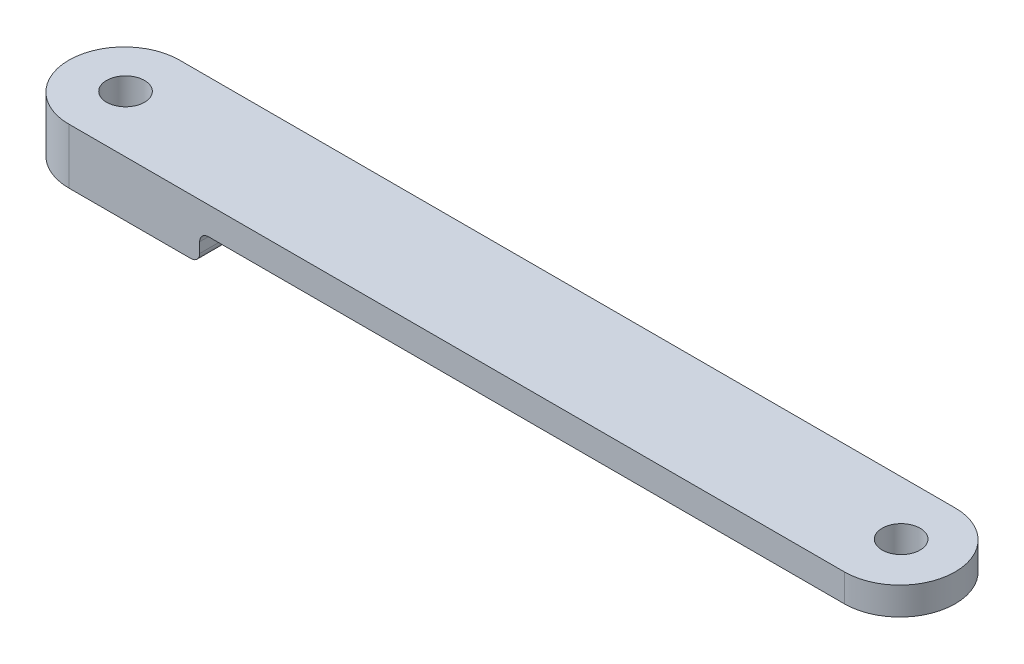
from build123d import *

# Parameters (mm, degrees)
BOSS_EXTRUDE1_DEPTH = 3.175
SKETCH2_R           = 2.175
CUT_EXTRUDE1_DEPTH  = 12.7
SKETCH4_R           = 2.175
BOSS_EXTRUDE3_DEPTH = 3.175
FILLET1_R           = 1


with BuildPart() as part:
    # Sketch1 → Boss-Extrude1 (new body)
    with BuildSketch(Plane(origin=(0, 0, 0), x_dir=(1, 0, 0), z_dir=(0, 1, 0))):
        with BuildLine():
            Line((-23.171929825, 5.625877193), (65.728070175, 5.625877193))
            ThreePointArc((65.728070175, 5.625877193), (72.078070175, -0.724122807), (65.728070175, -7.074122807))
            Line((65.728070175, -7.074122807), (-23.171929825, -7.074122807))
            ThreePointArc((-23.171929825, -7.074122807), (-29.521929825, -0.724122807), (-23.171929825, 5.625877193))
        make_face()
    extrude(amount=BOSS_EXTRUDE1_DEPTH)

    # Sketch2 → Cut-Extrude1 (cut)
    with BuildSketch(Plane(origin=(0, 3.175, 0), x_dir=(1, 0, 0), z_dir=(0, 1, 0))):
        with Locations((-23.171929825, -0.570780949)):
            Circle(SKETCH2_R)
        with Locations((65.728070175, -0.570780949)):
            Circle(SKETCH2_R)
    extrude(amount=-CUT_EXTRUDE1_DEPTH, mode=Mode.SUBTRACT)

    # Sketch4 → Boss-Extrude3 (add)
    with BuildSketch(Plane.XZ):
        with BuildLine():
            Line((-23.171929825, 7.074122807), (-8.171929825, 7.074122807))
            Line((-8.171929825, 7.074122807), (-8.171929825, -5.625877193))
            Line((-8.171929825, -5.625877193), (-23.171929825, -5.625877193))
            ThreePointArc((-23.171929825, -5.625877193), (-29.521929825, 0.724122807), (-23.171929825, 7.074122807))
        make_face()
        with Locations((-23.171929825, 0.570780949)):
            Circle(SKETCH4_R, mode=Mode.SUBTRACT)
    extrude(amount=BOSS_EXTRUDE3_DEPTH)

    # Fillet1
    fillet1_edges = [part.edges().sort_by_distance(p)[0] for p in [
        (-8.171929825, -3.175, 0.724122807),
        (-8.171929825, 0, 0.724122807),
    ]]
    fillet(fillet1_edges, radius=FILLET1_R)


solid = part.part
